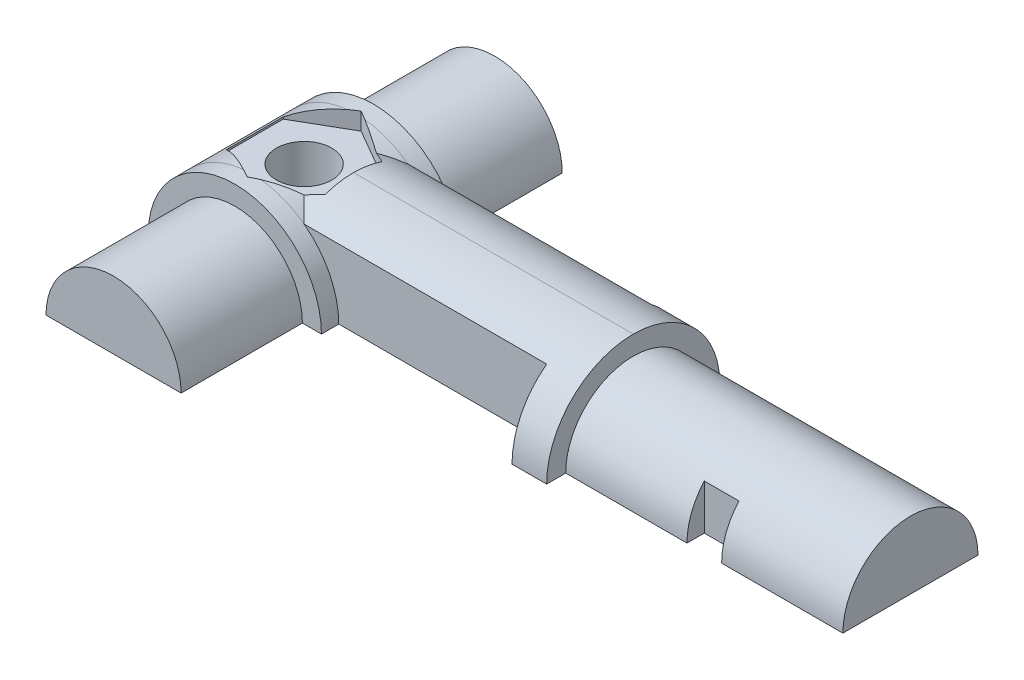
from build123d import *

# Parameters (mm, degrees)
SKETCH1_W           = 10
SKETCH1_H           = 6
BOSS_EXTRUDE1_DEPTH = 5
BOSS_EXTRUDE2_DEPTH = 1
BOSS_EXTRUDE3_DEPTH = 7
FILLET1_R           = 5
SKETCH4_W           = 6
SKETCH4_H           = 5
BOSS_EXTRUDE4_DEPTH = 12
SKETCH5_W           = 10
SKETCH5_H           = 5
BOSS_EXTRUDE5_DEPTH = 2
FILLET3_START       = 5.05342
FILLET3_DEPTH       = 13.94658
FILLET3_START_2     = 3
FILLET3_2_DEPTH     = 2.14658
FILLET3_3_DEPTH     = 3
FILLET3_START_3     = -3
FILLET3_4_DEPTH     = 6
BOSS_EXTRUDE6_DEPTH = 16
SKETCH7_R           = 1.6
SKETCH7_W           = 2
SKETCH7_H           = 1
CUT_EXTRUDE1_DEPTH  = 38.027017163
CUT_EXTRUDE6_DEPTH  = 1


with BuildPart() as part:
    # Sketch1 → Boss-Extrude1 (new body)
    with BuildSketch(Plane(origin=(0, 0, 0), x_dir=(1, 0, 0), z_dir=(0, 1, 0))):
        Rectangle(SKETCH1_W, SKETCH1_H)
    extrude(amount=BOSS_EXTRUDE1_DEPTH)

    # Sketch2 → Boss-Extrude2 (add)
    with BuildSketch(Plane.XY.offset(3)):
        with BuildLine():
            Line((5, 0), (-5, 0))
            ThreePointArc((-5, 0), (0, 5), (5, 0))
        make_face()
    boss_extrude2 = extrude(amount=BOSS_EXTRUDE2_DEPTH)

    # Sketch3 → Boss-Extrude3 (add)
    with BuildSketch(Plane.XY.offset(4)):
        with BuildLine():
            Line((-3.9, 0), (3.9, 0))
            ThreePointArc((3.9, 0), (0, 3.9), (-3.9, 0))
        make_face()
    boss_extrude3 = extrude(amount=BOSS_EXTRUDE3_DEPTH)

    # Mirror1: Boss-Extrude2, Boss-Extrude3 across plane
    add(boss_extrude2.mirror(Plane.XY))
    add(boss_extrude3.mirror(Plane.XY))

    # Fillet1
    fillet1_edges = [part.edges().sort_by_distance(p)[0] for p in [
        (-5, 5, 0),
    ]]
    fillet(fillet1_edges, radius=FILLET1_R - 0.0001)  # a hair under: the kernel refuses the full size

    # Sketch4 → Boss-Extrude4 (add)
    with BuildSketch(Plane(origin=(5, 0, 0), x_dir=(0, 0, -1), z_dir=(1, 0, 0))):
        with Locations((0, 2.5)):
            Rectangle(SKETCH4_W, SKETCH4_H)
    extrude(amount=BOSS_EXTRUDE4_DEPTH)

    # Sketch5 → Boss-Extrude5 (add)
    with BuildSketch(Plane(origin=(17, 0, 0), x_dir=(0, 0, -1), z_dir=(1, 0, 0))):
        with Locations((0, 2.5)):
            Rectangle(SKETCH5_W, SKETCH5_H)
    extrude(amount=BOSS_EXTRUDE5_DEPTH)

    # Fillet3: read off the stored shape, not the designer's step
    # Fillet3 outline → Fillet3 (cut)
    with BuildSketch(Plane.YZ.offset(FILLET3_START)):
        with BuildLine():
            ThreePointArc((5, 0), (3.535533906, -3.535533906), (0, -5))
            Line((0, -5), (5, -5))
            Line((5, -5), (5, 0))
        make_face()
        with BuildLine():
            Line((5, 0), (5, 5))
            Line((5, 5), (0, 5))
            ThreePointArc((0, 5), (3.535533906, 3.535533906), (5, 0))
        make_face()
    extrude(amount=FILLET3_DEPTH, mode=Mode.SUBTRACT)

    # Fillet3 2 outline → Fillet3 2 (cut)
    with BuildSketch(Plane.YZ.offset(FILLET3_START_2)):
        with BuildLine():
            Line((5, -3), (5, 0))
            ThreePointArc((5, 0), (4.74341649, -1.58113883), (4, -3))
            Line((4, -3), (5, -3))
        make_face()
        with BuildLine():
            ThreePointArc((4, 3), (4.74341649, 1.58113883), (5, 0))
            Line((5, 0), (5, 3))
            Line((5, 3), (4, 3))
        make_face()
    extrude(amount=FILLET3_2_DEPTH, mode=Mode.SUBTRACT)

    # Fillet3 3 outline → Fillet3 3 (cut)
    with BuildSketch(Plane.YZ):
        with BuildLine():
            Line((5, -3), (5, 0))
            ThreePointArc((5, 0), (4.74341649, -1.58113883), (4, -3))
            Line((4, -3), (5, -3))
        make_face()
        with BuildLine():
            ThreePointArc((4, 3), (4.74341649, 1.58113883), (5, 0))
            Line((5, 0), (5, 3))
            Line((5, 3), (4, 3))
        make_face()
    extrude(amount=FILLET3_3_DEPTH, mode=Mode.SUBTRACT)

    # Fillet3 4 outline → Fillet3 4 (add)
    with BuildSketch(Plane.XY.offset(FILLET3_START_3)):
        with BuildLine():
            ThreePointArc((3, 4), (1.58113883, 4.74341649), (0, 5))
            ThreePointArc((0, 5), (-0.50254481, 4.974680765), (-1, 4.898979485))
            Line((-1, 4.898979485), (-1, 2))
            Line((-1, 2), (4, 2))
            Line((4, 2), (4, 3.25))
            Line((4, 3.25), (3, 4))
        make_face()
    extrude(amount=FILLET3_4_DEPTH)

    # Sketch6 → Boss-Extrude6 (add)
    with BuildSketch(Plane(origin=(19, 0, 0), x_dir=(0, 0, -1), z_dir=(1, 0, 0))):
        with BuildLine():
            Line((-3.9, 0), (3.9, 0))
            ThreePointArc((3.9, 0), (0, 3.9), (-3.9, 0))
        make_face()
    extrude(amount=BOSS_EXTRUDE6_DEPTH)

    # Sketch7 → Cut-Extrude1 (cut, through all)
    with BuildSketch(Plane(origin=(0, 0, 0), x_dir=(-1, 0, 0), z_dir=(0, -1, 0))):
        with Locations(Location((0, 0, 0), (0, 0, 90))):
            Circle(SKETCH7_R)
        with Locations((-27, -3.4)):
            Rectangle(SKETCH7_W, SKETCH7_H)
        with Locations((-27, 3.4)):
            Rectangle(SKETCH7_W, SKETCH7_H)
    extrude(amount=-CUT_EXTRUDE1_DEPTH, mode=Mode.SUBTRACT)

    # Sketch9 → Cut-Extrude6 (cut)
    with BuildSketch(Plane(origin=(0, 5, 0), x_dir=(-1, 0, 0), z_dir=(0, -1, 0))):
        Polygon((-2.85, 1.645448267), (-2.85, -1.645448267), (0, -3.290896534), (2.85, -1.645448267), (2.85, 1.645448267), (0, 3.290896534), align=None)
    extrude(amount=CUT_EXTRUDE6_DEPTH, mode=Mode.SUBTRACT)


solid = part.part
